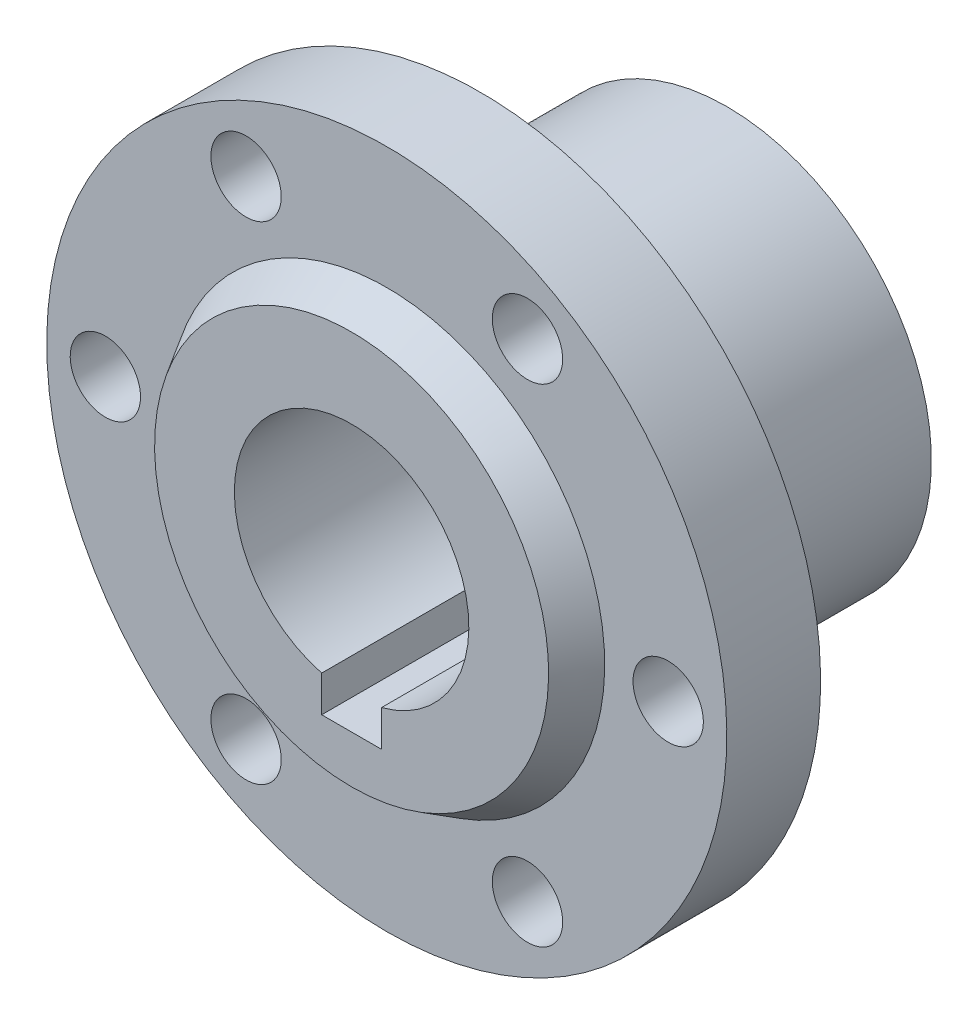
from build123d import *

# Parameters (mm, degrees)
CUT_EXTRUDE1_DEPTH      = 47.076024134
CUT_EXTRUDE1_DEPTH_BACK = 47.076024134
CUT_EXTRUDE2_DEPTH      = 47.076024134
CUT_EXTRUDE2_DEPTH_BACK = 47.076024134
SKETCH3_R               = 3


with BuildPart() as part:
    # Sketch1 → Revolve1 (revolve)
    with BuildSketch(Plane(origin=(0, 0, 0), x_dir=(0, 0, -1), z_dir=(1, 0, 0))):
        Polygon((21, 17.45), (7.03, 17.45), (7.03, 18.5), (0, 18.5), (0, 29), (-8, 29), (-8, 18.586235054), (-11, 16.803216346), (-11, 10), (21, 10), align=None)
    revolve(axis=Axis((0, 0, 11), (0, 0, -1)))

    # Sketch2 → Cut-Extrude1 (cut, two sides: drawn at the far end of the back side and taken through both)
    with BuildSketch(Plane.XY.offset(-CUT_EXTRUDE1_DEPTH_BACK)):
        with BuildLine():
            Line((-2.55, -12.75), (2.55, -12.75))
            Line((2.55, -12.75), (2.55, -9.66941053))
            ThreePointArc((2.55, -9.66941053), (0, -10), (-2.55, -9.66941053))
            Line((-2.55, -9.66941053), (-2.55, -12.75))
        make_face()
    extrude(amount=CUT_EXTRUDE1_DEPTH + CUT_EXTRUDE1_DEPTH_BACK, mode=Mode.SUBTRACT)

    # Sketch3 → Cut-Extrude2 (cut, two sides: drawn at the far end of the back side and taken through both)
    with BuildSketch(Plane(origin=(0, 0, 0), x_dir=(-1, 0, 0), z_dir=(0, 0, -1)).offset(-CUT_EXTRUDE2_DEPTH_BACK)):
        with Locations((-24, 0)):
            Circle(SKETCH3_R)
        with Locations((-12, 20.784609691)):
            Circle(SKETCH3_R)
        with Locations((12, 20.784609691)):
            Circle(SKETCH3_R)
        with Locations((24, 0)):
            Circle(SKETCH3_R)
        with Locations((12, -20.784609691)):
            Circle(SKETCH3_R)
        with Locations((-12, -20.784609691)):
            Circle(SKETCH3_R)
    extrude(amount=CUT_EXTRUDE2_DEPTH + CUT_EXTRUDE2_DEPTH_BACK, mode=Mode.SUBTRACT)


solid = part.part
